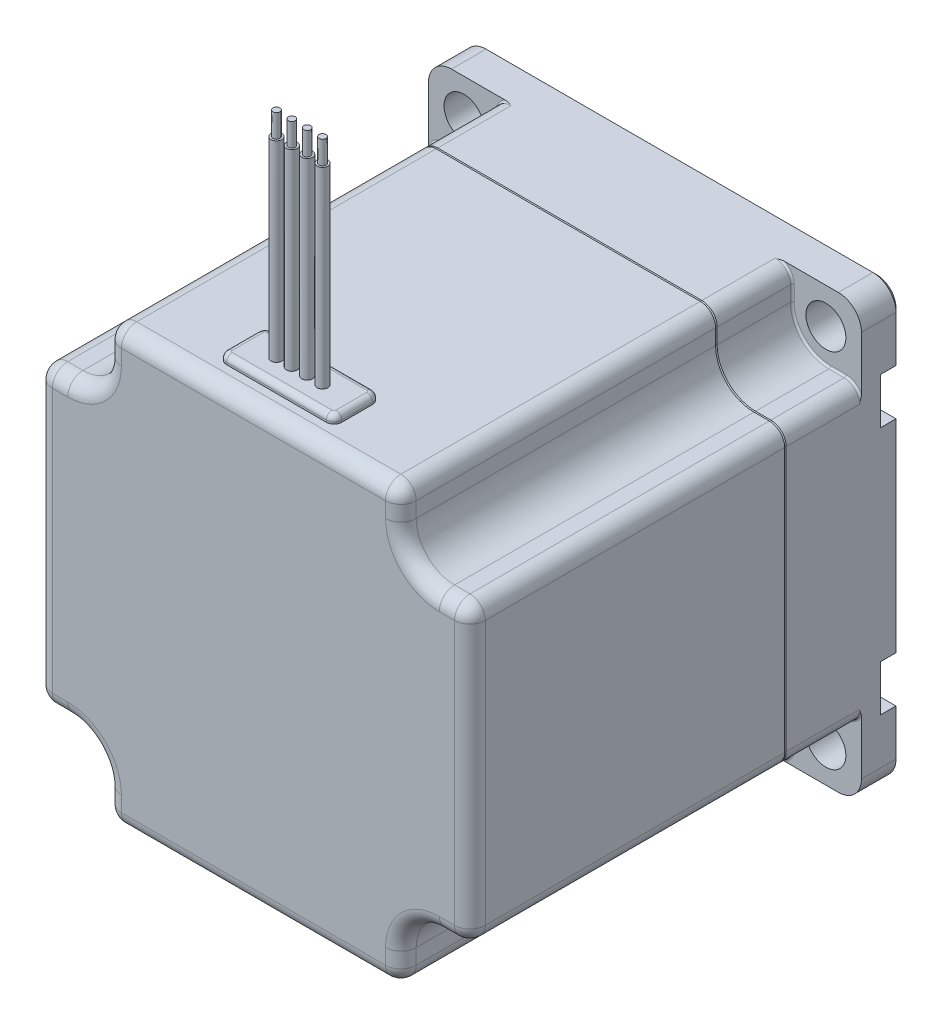
from build123d import *

# Parameters (mm, degrees)
BOSS_EXTRUDE1_DEPTH        = 15
F_5_2_5_2_DIAMETER_HOLE1_D = 5.2
CUT_EXTRUDE1_DEPTH         = 10
FILLET1_R                  = 2
SKETCH6_R                  = 19.05
BOSS_EXTRUDE2_DEPTH        = 1.6
BOSS_EXTRUDE3_DEPTH        = 21
CUT_EXTRUDE2_DEPTH         = 2.5
CHAMFER2_SIZE              = 0.5
CHAMFER3_SIZE              = 0.5
FILLET3_R                  = 0.25
CHAMFER3_OF_MIRROR1_SIZE   = 0.5
MIRROR2_START              = 25.2
MIRROR2_2_DEPTH            = 3.8
MIRROR2_3_DEPTH            = 3
CHAMFER4_SIZE              = 0.2
CHAMFER5_SIZE              = 0.2
BOSS_EXTRUDE4_DEPTH        = 41
FILLET4_R                  = 2
CUT_EXTRUDE3_START         = -1
SKETCH10_R                 = 7.5
CUT_EXTRUDE3_DEPTH         = 1
BOSS_EXTRUDE5_DEPTH        = 1
FILLET5_R                  = 0.75
SKETCH12_R                 = 0.7
BOSS_EXTRUDE6_DEPTH        = 25
LPATTERN1_COUNT            = 2
LPATTERN1_PITCH            = 2
LPATTERN2_COUNT            = 2
LPATTERN2_PITCH            = 4
LPATTERN3_COUNT            = 2
LPATTERN3_PITCH            = 6
SKETCH13_R                 = 0.45
BOSS_EXTRUDE7_DEPTH        = 3
LPATTERN4_COUNT            = 4
LPATTERN4_PITCH            = 2


with BuildPart() as part:
    # Sketch1 → Boss-Extrude1 (new body)
    with BuildSketch(Plane.XY):
        with BuildLine():
            Line((-25.2, -28.2), (25.2, -28.2))
            ThreePointArc((25.2, -28.2), (27.321320344, -27.321320344), (28.2, -25.2))
            Line((28.2, -25.2), (28.2, 25.2))
            ThreePointArc((28.2, 25.2), (27.321320344, 27.321320344), (25.2, 28.2))
            Line((25.2, 28.2), (-25.2, 28.2))
            ThreePointArc((-25.2, 28.2), (-27.321320344, 27.321320344), (-28.2, 25.2))
            Line((-28.2, 25.2), (-28.2, -25.2))
            ThreePointArc((-28.2, -25.2), (-27.321320344, -27.321320344), (-25.2, -28.2))
        make_face()
    extrude(amount=BOSS_EXTRUDE1_DEPTH)

    # Ø5.2 (5.2) Diameter Hole1 (through all)
    with Locations(Plane.XY.offset(15)):
        with Locations((-23.57, 23.57), (23.57, 23.57), (23.57, -23.57), (-23.57, -23.57)):
            Hole(F_5_2_5_2_DIAMETER_HOLE1_D / 2)

    # Sketch5 → Cut-Extrude1 (cut)
    with BuildSketch(Plane.XY.offset(15)):
        with BuildLine():
            Line((-28.2, 28.2), (-19.2, 28.2))
            Line((-19.2, 28.2), (-19.2, 24.2))
            ThreePointArc((-19.2, 24.2), (-20.664466094, 20.664466094), (-24.2, 19.2))
            Line((-24.2, 19.2), (-28.2, 19.2))
            Line((-28.2, 19.2), (-28.2, 28.2))
        make_face()
        with BuildLine():
            Line((19.2, 28.2), (19.2, 24.2))
            ThreePointArc((19.2, 24.2), (20.664466094, 20.664466094), (24.2, 19.2))
            Line((24.2, 19.2), (28.2, 19.2))
            Line((28.2, 19.2), (28.2, 28.2))
            Line((28.2, 28.2), (19.2, 28.2))
        make_face()
        with BuildLine():
            Line((28.2, -28.2), (19.2, -28.2))
            Line((19.2, -28.2), (19.2, -24.2))
            ThreePointArc((19.2, -24.2), (20.664466094, -20.664466094), (24.2, -19.2))
            Line((24.2, -19.2), (28.2, -19.2))
            Line((28.2, -19.2), (28.2, -28.2))
        make_face()
        with BuildLine():
            Line((-19.2, -28.2), (-19.2, -24.2))
            ThreePointArc((-19.2, -24.2), (-20.664466094, -20.664466094), (-24.2, -19.2))
            Line((-24.2, -19.2), (-28.2, -19.2))
            Line((-28.2, -19.2), (-28.2, -28.2))
            Line((-28.2, -28.2), (-19.2, -28.2))
        make_face()
    extrude(amount=-CUT_EXTRUDE1_DEPTH, mode=Mode.SUBTRACT)

    # Fillet1
    fillet1_edges = [part.edges().sort_by_distance(p)[0] for p in [
        (-19.2, -28.2, 10),
        (-28.2, -19.2, 10),
        (-28.2, 19.2, 10),
        (-19.2, 28.2, 10),
        (19.2, 28.2, 10),
        (28.2, 19.2, 10),
        (28.2, -19.2, 10),
        (19.2, -28.2, 10),
    ]]
    fillet(fillet1_edges, radius=FILLET1_R)

    # Sketch6 → Boss-Extrude2 (add)
    with BuildSketch(Plane(origin=(0, 0, 0), x_dir=(-1, 0, 0), z_dir=(0, 0, -1))):
        Circle(SKETCH6_R)
    extrude(amount=BOSS_EXTRUDE2_DEPTH)

    # Sketch7 → Boss-Extrude3 (add)
    with BuildSketch(Plane(origin=(0, 0, 0), x_dir=(-1, 0, 0), z_dir=(0, 0, -1))):
        with BuildLine():
            Line((-1.449137675, 2.825), (1.449137675, 2.825))
            ThreePointArc((1.449137675, 2.825), (0, -3.175), (-1.449137675, 2.825))
        make_face()
    extrude(amount=BOSS_EXTRUDE3_DEPTH)

    # Chamfer1: read off the stored shape, not the designer's step
    # Chamfer1 outline → Chamfer1 (revolve, cut)
    with BuildSketch(Plane.XZ):
        Polygon((3.175, -20.5), (2.675, -21), (3.175, -21), align=None)
    revolve(axis=Axis((0, 0, 0), (0, 0, 1)), mode=Mode.SUBTRACT)

    # Sketch8 → Cut-Extrude2 (cut)
    with BuildSketch(Plane(origin=(0, 0, 0), x_dir=(-1, 0, 0), z_dir=(0, 0, -1))):
        with BuildLine():
            Line((25.2, 19.2), (28.2, 19.2))
            Line((28.2, 19.2), (28.2, 13.2))
            Line((28.2, 13.2), (25.2, 13.2))
            ThreePointArc((25.2, 13.2), (22.2, 16.2), (25.2, 19.2))
        make_face()
    cut_extrude2 = extrude(amount=-CUT_EXTRUDE2_DEPTH, mode=Mode.SUBTRACT)

    # Chamfer2
    chamfer2_edges = [part.edges().sort_by_distance(p)[0] for p in [
        (0, 28.2, 0),
        (27.321320344, 27.321320344, 0),
        (-28.2, -6, 0),
        (28.2, 0, 0),
        (27.321320344, -27.321320344, 0),
        (0, -28.2, 0),
        (-27.321320344, -27.321320344, 0),
        (-28.2, 22.2, 0),
        (-27.321320344, 27.321320344, 0),
    ]]
    chamfer(chamfer2_edges, length=CHAMFER2_SIZE)

    # Chamfer3
    chamfer3_edges = [part.edges().sort_by_distance(p)[0] for p in [
        (-26.45, 13.2, 0),
        (-22.2, 16.2, 0),
        (-26.45, 19.2, 0),
    ]]
    chamfer(chamfer3_edges, length=CHAMFER3_SIZE)

    # Fillet3
    # the kernel refuses this fillet: 0.25 mm, written as the material it adds along each edge
    with BuildSketch(Plane(origin=(-24.2, -24.2, 5), x_dir=(1, 0, 0), z_dir=(0, -1, 0))) as fillet3_piece_1:
        with BuildLine():
            CenterArc((5 - FILLET3_R, FILLET3_R), FILLET3_R, 270, 90)
            Line((5, FILLET3_R), (5, 0))
            Line((5, 0), (5 - FILLET3_R, 0))
        make_face()
    revolve(axis=Axis((-24.2, -24.2, 5), (0, 0, 1)), revolution_arc=90)
    with BuildSketch(Plane(origin=(-24.2, -19.2, 5), x_dir=(0, -1, 0), z_dir=(-1, 0, 0)), Plane(origin=(19.2, 26.2, 5), x_dir=(1, 0, 0), z_dir=(0, -1, 0)), Plane(origin=(-19.2, -26.2, 5), x_dir=(-1, 0, 0), z_dir=(0, 1, 0)), Plane(origin=(24.2, 19.2, 5), x_dir=(0, 1, 0), z_dir=(1, 0, 0))) as fillet3_piece_2:
        with BuildLine():
            CenterArc((FILLET3_R, FILLET3_R), FILLET3_R, 180, 90)
            Line((0, FILLET3_R), (0, 0))
            Line((0, 0), (FILLET3_R, 0))
        make_face()
    extrude(amount=2)
    with BuildSketch(Plane(origin=(24.2, -19.2, 5), x_dir=(0, -1, 0), z_dir=(1, 0, 0)), Plane(origin=(-24.2, 19.2, 5), x_dir=(0, 1, 0), z_dir=(-1, 0, 0)), Plane(origin=(-19.2, 26.2, 5), x_dir=(-1, 0, 0), z_dir=(0, -1, 0)), Plane(origin=(19.2, -26.2, 5), x_dir=(1, 0, 0), z_dir=(0, 1, 0))) as fillet3_piece_3:
        with BuildLine():
            CenterArc((FILLET3_R, -FILLET3_R), FILLET3_R, 90, 90)
            Line((0, -FILLET3_R), (0, 0))
            Line((0, 0), (FILLET3_R, 0))
        make_face()
    extrude(amount=2)
    with BuildSketch(Plane(origin=(17.2, 26.2, 5), x_dir=(-0.5067954377401612, 0.8620663456403795, 0), z_dir=(-0.8620663456403795, -0.5067954377401612, 0))) as fillet3_piece_4_section:
        with BuildLine():
            CenterArc((2 + FILLET3_R, -FILLET3_R), FILLET3_R, 90, 90)
            Line((2, -FILLET3_R), (2, 0))
            Line((2, 0), (2 + FILLET3_R, 0))
        make_face()
    fillet3_piece_4 = revolve(axis=Axis((17.2, 26.2, 5), (0, 0, -1)), revolution_arc=120.450610213, mode=Mode.PRIVATE)
    fillet3_piece_4 = split(fillet3_piece_4, bisect_by=Plane(origin=(17.2, 28.2, 5), z_dir=(0, -1, 0)), keep=Keep.TOP, mode=Mode.PRIVATE)
    add(fillet3_piece_4)
    with BuildSketch(Plane(origin=(26.2, 17.2, 5), x_dir=(0.8620663456403796, -0.5067954377401613, 0), z_dir=(-0.5067954377401613, -0.8620663456403796, 0))) as fillet3_piece_5_section:
        with BuildLine():
            CenterArc((2 + FILLET3_R, FILLET3_R), FILLET3_R, 180, 90)
            Line((2, FILLET3_R), (2, 0))
            Line((2, 0), (2 + FILLET3_R, 0))
        make_face()
    fillet3_piece_5 = revolve(axis=Axis((26.2, 17.2, 5), (0, 0, 1)), revolution_arc=120.450610213, mode=Mode.PRIVATE)
    fillet3_piece_5 = split(fillet3_piece_5, bisect_by=Plane(origin=(28.2, 17.2, 5), z_dir=(-1, 0, 0)), keep=Keep.TOP, mode=Mode.PRIVATE)
    add(fillet3_piece_5)
    with BuildSketch(Plane(origin=(26.2, -17.2, 5), x_dir=(0.86206634564038, 0.5067954377401604, 0), z_dir=(-0.5067954377401604, 0.86206634564038, 0))) as fillet3_piece_6_section:
        with BuildLine():
            CenterArc((2 + FILLET3_R, -FILLET3_R), FILLET3_R, 90, 90)
            Line((2, -FILLET3_R), (2, 0))
            Line((2, 0), (2 + FILLET3_R, 0))
        make_face()
    fillet3_piece_6 = revolve(axis=Axis((26.2, -17.2, 5), (0, 0, -1)), revolution_arc=120.450610213, mode=Mode.PRIVATE)
    fillet3_piece_6 = split(fillet3_piece_6, bisect_by=Plane(origin=(28.2, -17.2, 5), z_dir=(-1, 0, 0)), keep=Keep.TOP, mode=Mode.PRIVATE)
    add(fillet3_piece_6)
    with BuildSketch(Plane(origin=(17.2, -26.2, 5), x_dir=(-0.5067954377401612, -0.8620663456403795, 0), z_dir=(-0.8620663456403795, 0.5067954377401612, 0))) as fillet3_piece_7_section:
        with BuildLine():
            CenterArc((2 + FILLET3_R, FILLET3_R), FILLET3_R, 180, 90)
            Line((2, FILLET3_R), (2, 0))
            Line((2, 0), (2 + FILLET3_R, 0))
        make_face()
    fillet3_piece_7 = revolve(axis=Axis((17.2, -26.2, 5), (0, 0, 1)), revolution_arc=120.450610213, mode=Mode.PRIVATE)
    fillet3_piece_7 = split(fillet3_piece_7, bisect_by=Plane(origin=(17.2, -28.2, 5), z_dir=(0, 1, 0)), keep=Keep.TOP, mode=Mode.PRIVATE)
    add(fillet3_piece_7)
    with BuildSketch(Plane(origin=(-17.2, -26.2, 5), x_dir=(0.5067954377401612, -0.8620663456403795, 0), z_dir=(0.8620663456403795, 0.5067954377401612, 0))) as fillet3_piece_8_section:
        with BuildLine():
            CenterArc((2 + FILLET3_R, -FILLET3_R), FILLET3_R, 90, 90)
            Line((2, -FILLET3_R), (2, 0))
            Line((2, 0), (2 + FILLET3_R, 0))
        make_face()
    fillet3_piece_8 = revolve(axis=Axis((-17.2, -26.2, 5), (0, 0, -1)), revolution_arc=120.450610213, mode=Mode.PRIVATE)
    fillet3_piece_8 = split(fillet3_piece_8, bisect_by=Plane(origin=(-17.2, -28.2, 5), z_dir=(0, 1, 0)), keep=Keep.TOP, mode=Mode.PRIVATE)
    add(fillet3_piece_8)
    with BuildSketch(Plane(origin=(-26.2, -17.2, 5), x_dir=(-0.86206634564038, 0.5067954377401604, 0), z_dir=(0.5067954377401604, 0.86206634564038, 0))) as fillet3_piece_9_section:
        with BuildLine():
            CenterArc((2 + FILLET3_R, FILLET3_R), FILLET3_R, 180, 90)
            Line((2 + FILLET3_R, 0), (2, 0))
            Line((2, 0), (2, FILLET3_R))
        make_face()
    fillet3_piece_9 = revolve(axis=Axis((-26.2, -17.2, 5), (0, 0, 1)), revolution_arc=120.450610213, mode=Mode.PRIVATE)
    fillet3_piece_9 = split(fillet3_piece_9, bisect_by=Plane(origin=(-28.2, -17.2, 5), z_dir=(1, 0, 0)), keep=Keep.TOP, mode=Mode.PRIVATE)
    add(fillet3_piece_9)
    with BuildSketch(Plane(origin=(-26.2, 17.2, 5), x_dir=(-0.8620663456403796, -0.5067954377401613, 0), z_dir=(0.5067954377401613, -0.8620663456403796, 0))) as fillet3_piece_10_section:
        with BuildLine():
            CenterArc((2 + FILLET3_R, -FILLET3_R), FILLET3_R, 90, 90)
            Line((2, -FILLET3_R), (2, 0))
            Line((2, 0), (2 + FILLET3_R, 0))
        make_face()
    fillet3_piece_10 = revolve(axis=Axis((-26.2, 17.2, 5), (0, 0, -1)), revolution_arc=120.450610213, mode=Mode.PRIVATE)
    fillet3_piece_10 = split(fillet3_piece_10, bisect_by=Plane(origin=(-28.2, 17.2, 5), z_dir=(1, 0, 0)), keep=Keep.TOP, mode=Mode.PRIVATE)
    add(fillet3_piece_10)
    with BuildSketch(Plane(origin=(-17.2, 26.2, 5), x_dir=(0.5067954377401612, 0.8620663456403795, 0), z_dir=(0.8620663456403795, -0.5067954377401612, 0))) as fillet3_piece_11_section:
        with BuildLine():
            CenterArc((2 + FILLET3_R, FILLET3_R), FILLET3_R, 180, 90)
            Line((2, FILLET3_R), (2, 0))
            Line((2, 0), (2 + FILLET3_R, 0))
        make_face()
    fillet3_piece_11 = revolve(axis=Axis((-17.2, 26.2, 5), (0, 0, 1)), revolution_arc=120.450610213, mode=Mode.PRIVATE)
    fillet3_piece_11 = split(fillet3_piece_11, bisect_by=Plane(origin=(-17.2, 28.2, 5), z_dir=(0, -1, 0)), keep=Keep.TOP, mode=Mode.PRIVATE)
    add(fillet3_piece_11)
    with BuildSketch(Plane(origin=(-24.2, 24.2, 5), x_dir=(1, 0, 0), z_dir=(0, 1, 0))) as fillet3_piece_12:
        with BuildLine():
            CenterArc((5 - FILLET3_R, -FILLET3_R), FILLET3_R, 0, 90)
            Line((5, -FILLET3_R), (5, 0))
            Line((5, 0), (5 - FILLET3_R, 0))
        make_face()
    revolve(axis=Axis((-24.2, 24.2, 5), (0, 0, -1)), revolution_arc=90)
    with BuildSketch(Plane(origin=(24.2, 24.2, 5), x_dir=(-1, 0, 0), z_dir=(0, 1, 0))) as fillet3_piece_13:
        with BuildLine():
            CenterArc((5 - FILLET3_R, FILLET3_R), FILLET3_R, 270, 90)
            Line((5, FILLET3_R), (5, 0))
            Line((5, 0), (5 - FILLET3_R, 0))
        make_face()
    revolve(axis=Axis((24.2, 24.2, 5), (0, 0, 1)), revolution_arc=90)
    with BuildSketch(Plane(origin=(24.2, -24.2, 5), x_dir=(-1, 0, 0), z_dir=(0, -1, 0))) as fillet3_piece_14:
        with BuildLine():
            CenterArc((5 - FILLET3_R, -FILLET3_R), FILLET3_R, 0, 90)
            Line((5, -FILLET3_R), (5, 0))
            Line((5, 0), (5 - FILLET3_R, 0))
        make_face()
    revolve(axis=Axis((24.2, -24.2, 5), (0, 0, -1)), revolution_arc=90)

    # Mirror1: Cut-Extrude2 across plane
    add(cut_extrude2.mirror(Plane.ZX), mode=Mode.SUBTRACT)

    # Chamfer3 of Mirror1
    chamfer3_of_mirror1_edges = [part.edges().sort_by_distance(p)[0] for p in [
        (-26.45, -13.2, 0),
        (-22.2, -16.2, 0),
        (-26.45, -19.2, 0),
    ]]
    chamfer(chamfer3_of_mirror1_edges, length=CHAMFER3_OF_MIRROR1_SIZE)

    # Mirror2: read off the stored shape, not the designer's step
    # Mirror2 outline → Mirror2 (revolve, cut)
    with BuildSketch(Plane(origin=(25.2, -16.2, 0), x_dir=(1, 0, 0), z_dir=(0, -1, 0))):
        Polygon((3, 0.5), (3, 2.5), (0, 2.5), (0, 0), (3.5, 0), align=None)
    revolve(axis=Axis((25.2, -16.2, 0), (0, 0, 1)), mode=Mode.SUBTRACT)

    # Mirror2 2 outline → Mirror2 2 (cut)
    with BuildSketch(Plane.YZ.offset(MIRROR2_START)):
        Polygon((-19.7, 0), (-12.7, 0), (-13.2, 0.5), (-13.2, 2.5), (-19.2, 2.5), (-19.2, 0.5), align=None)
        Polygon((19.2, 0.5), (19.2, 2.5), (13.2, 2.5), (13.2, 0.5), (12.7, 0), (19.7, 0), align=None)
    extrude(amount=MIRROR2_2_DEPTH, mode=Mode.SUBTRACT)

    # Mirror2 3 outline → Mirror2 3 (cut)
    with BuildSketch(Plane.YZ.offset(MIRROR2_START)):
        Polygon((-12.7, 0), (-13.2, 0.5), (-13.2, 2.5), (-19.2, 2.5), (-19.2, 0.5), (-19.7, 0), align=None)
    extrude(amount=MIRROR2_3_DEPTH, mode=Mode.SUBTRACT)

    # Mirror2 4 outline → Mirror2 4 (revolve, cut)
    with BuildSketch(Plane(origin=(25.2, 16.2, 0), x_dir=(1, 0, 0), z_dir=(0, -1, 0))):
        Polygon((3, 0.5), (3, 2.5), (0, 2.5), (0, 0), (3.5, 0), align=None)
    revolve(axis=Axis((25.2, 16.2, 0), (0, 0, 1)), mode=Mode.SUBTRACT)

    # Chamfer4
    chamfer4_edges = [part.edges().sort_by_distance(p)[0] for p in [
        (-20.97, -23.57, 0),
        (26.17, -23.57, 0),
        (26.17, 23.57, 0),
        (-20.97, 23.57, 0),
    ]]
    chamfer(chamfer4_edges, length=CHAMFER4_SIZE)

    # Chamfer5
    chamfer5_edges = [part.edges().sort_by_distance(p)[0] for p in [
        (-20.664466094, -20.664466094, 15),
        (-25.2, -19.2, 15),
        (19.2, 25.2, 15),
        (-19.2, -25.2, 15),
        (0, -28.2, 15),
        (25.2, -19.2, 15),
        (28.2, 0, 15),
        (0, 28.2, 15),
        (-25.2, 19.2, 15),
        (-28.2, 0, 15),
        (-18.614213562, 27.614213562, 15),
        (-27.614213562, 18.614213562, 15),
        (-27.614213562, -18.614213562, 15),
        (-18.614213562, -27.614213562, 15),
        (18.614213562, -27.614213562, 15),
        (27.614213562, -18.614213562, 15),
        (27.614213562, 18.614213562, 15),
        (18.614213562, 27.614213562, 15),
        (-20.664466094, 20.664466094, 15),
        (-19.2, 25.2, 15),
        (20.664466094, 20.664466094, 15),
        (25.2, 19.2, 15),
        (20.664466094, -20.664466094, 15),
        (19.2, -25.2, 15),
    ]]
    chamfer(chamfer5_edges, length=CHAMFER5_SIZE)

    # Sketch9 → Boss-Extrude4 (add)
    with BuildSketch(Plane.XY.offset(15)):
        with BuildLine():
            Line((-17.2, 28.2), (17.2, 28.2))
            ThreePointArc((17.2, 28.2), (18.614213562, 27.614213562), (19.2, 26.2))
            Line((19.2, 26.2), (19.2, 24.2))
            ThreePointArc((19.2, 24.2), (20.664466094, 20.664466094), (24.2, 19.2))
            Line((24.2, 19.2), (26.2, 19.2))
            ThreePointArc((26.2, 19.2), (27.614213562, 18.614213562), (28.2, 17.2))
            Line((28.2, 17.2), (28.2, -17.2))
            ThreePointArc((28.2, -17.2), (27.614213562, -18.614213562), (26.2, -19.2))
            Line((26.2, -19.2), (24.2, -19.2))
            ThreePointArc((24.2, -19.2), (20.664466094, -20.664466094), (19.2, -24.2))
            Line((19.2, -24.2), (19.2, -26.2))
            ThreePointArc((19.2, -26.2), (18.614213562, -27.614213562), (17.2, -28.2))
            Line((17.2, -28.2), (-17.2, -28.2))
            ThreePointArc((-17.2, -28.2), (-18.614213562, -27.614213562), (-19.2, -26.2))
            Line((-19.2, -26.2), (-19.2, -24.2))
            ThreePointArc((-19.2, -24.2), (-20.664466094, -20.664466094), (-24.2, -19.2))
            Line((-24.2, -19.2), (-26.2, -19.2))
            ThreePointArc((-26.2, -19.2), (-27.614213562, -18.614213562), (-28.2, -17.2))
            Line((-28.2, -17.2), (-28.2, 17.2))
            ThreePointArc((-28.2, 17.2), (-27.614213562, 18.614213562), (-26.2, 19.2))
            Line((-26.2, 19.2), (-24.2, 19.2))
            ThreePointArc((-24.2, 19.2), (-20.664466094, 20.664466094), (-19.2, 24.2))
            Line((-19.2, 24.2), (-19.2, 26.2))
            ThreePointArc((-19.2, 26.2), (-18.614213562, 27.614213562), (-17.2, 28.2))
        make_face()
    extrude(amount=BOSS_EXTRUDE4_DEPTH)

    # Fillet4
    fillet4_edges = [part.edges().sort_by_distance(p)[0] for p in [
        (-18.614213562, 27.614213562, 56),
        (-19.2, 25.2, 56),
        (-20.664466094, 20.664466094, 56),
        (-25.2, 19.2, 56),
        (-27.614213562, 18.614213562, 56),
        (-28.2, 0, 56),
        (-27.614213562, -18.614213562, 56),
        (-25.2, -19.2, 56),
        (-20.664466094, -20.664466094, 56),
        (-19.2, -25.2, 56),
        (-18.614213562, -27.614213562, 56),
        (0, -28.2, 56),
        (18.614213562, -27.614213562, 56),
        (19.2, -25.2, 56),
        (20.664466094, -20.664466094, 56),
        (25.2, -19.2, 56),
        (27.614213562, -18.614213562, 56),
        (28.2, 0, 56),
        (27.614213562, 18.614213562, 56),
        (25.2, 19.2, 56),
        (20.664466094, 20.664466094, 56),
        (19.2, 25.2, 56),
        (18.614213562, 27.614213562, 56),
        (0, 28.2, 56),
    ]]
    fillet(fillet4_edges, radius=FILLET4_R)

    # Sketch10 → Cut-Extrude3 (cut)
    with BuildSketch(Plane(origin=(0, 0, -1.6), x_dir=(-1, 0, 0), z_dir=(0, 0, -1)).offset(CUT_EXTRUDE3_START)):
        Circle(SKETCH10_R)
        with BuildLine():
            Line((-1.449137675, 2.825), (1.449137675, 2.825))
            ThreePointArc((1.449137675, 2.825), (0, -3.175), (-1.449137675, 2.825))
        make_face(mode=Mode.SUBTRACT)
    extrude(amount=CUT_EXTRUDE3_DEPTH, mode=Mode.SUBTRACT)

    # Sketch11 → Boss-Extrude5 (add)
    with BuildSketch(Plane(origin=(0, 28.2, 0), x_dir=(1, 0, 0), z_dir=(0, 1, 0))):
        with BuildLine():
            Line((-6.5, -53), (6.5, -53))
            ThreePointArc((6.5, -53), (7.207106781, -52.707106781), (7.5, -52))
            Line((7.5, -52), (7.5, -48))
            ThreePointArc((7.5, -48), (7.207106781, -47.292893219), (6.5, -47))
            Line((6.5, -47), (-6.5, -47))
            ThreePointArc((-6.5, -47), (-7.207106781, -47.292893219), (-7.5, -48))
            Line((-7.5, -48), (-7.5, -52))
            ThreePointArc((-7.5, -52), (-7.207106781, -52.707106781), (-6.5, -53))
        make_face()
    extrude(amount=BOSS_EXTRUDE5_DEPTH)

    # Fillet5
    fillet5_edges = [part.edges().sort_by_distance(p)[0] for p in [
        (7.207106781, 29.2, 47.292893219),
        (0, 29.2, 47),
        (-7.207106781, 29.2, 47.292893219),
        (-7.5, 29.2, 50),
        (-7.207106781, 29.2, 52.707106781),
        (0, 29.2, 53),
        (7.207106781, 29.2, 52.707106781),
        (7.5, 29.2, 50),
    ]]
    fillet(fillet5_edges, radius=FILLET5_R)

    # Sketch12 → Boss-Extrude6 (add)
    with BuildSketch(Plane(origin=(0, 29.2, 0), x_dir=(1, 0, 0), z_dir=(0, 1, 0))):
        with Locations(Location((-3, -50, 0), (0, 0, 90))):
            Circle(SKETCH12_R)
    boss_extrude6 = extrude(amount=BOSS_EXTRUDE6_DEPTH)

    # LPattern1: Boss-Extrude6 ×2
    with Locations(*[(i * LPATTERN1_PITCH, 0, 0) for i in range(1, LPATTERN1_COUNT)]):
        add(boss_extrude6)

    # LPattern2: Boss-Extrude6 ×2
    with Locations(*[(i * LPATTERN2_PITCH, 0, 0) for i in range(1, LPATTERN2_COUNT)]):
        add(boss_extrude6)

    # LPattern3: Boss-Extrude6 ×2
    with Locations(*[(i * LPATTERN3_PITCH, 0, 0) for i in range(1, LPATTERN3_COUNT)]):
        add(boss_extrude6)

    # Sketch13 → Boss-Extrude7 (add)
    with BuildSketch(Plane(origin=(0, 54.2, 0), x_dir=(1, 0, 0), z_dir=(0, 1, 0))):
        with Locations(Location((-3, -50, 0), (0, 0, 270))):
            Circle(SKETCH13_R)
    boss_extrude7 = extrude(amount=BOSS_EXTRUDE7_DEPTH)

    # LPattern4: Boss-Extrude7 ×4
    with Locations(*[(i * LPATTERN4_PITCH, 0, 0) for i in range(1, LPATTERN4_COUNT)]):
        add(boss_extrude7)


solid = part.part
